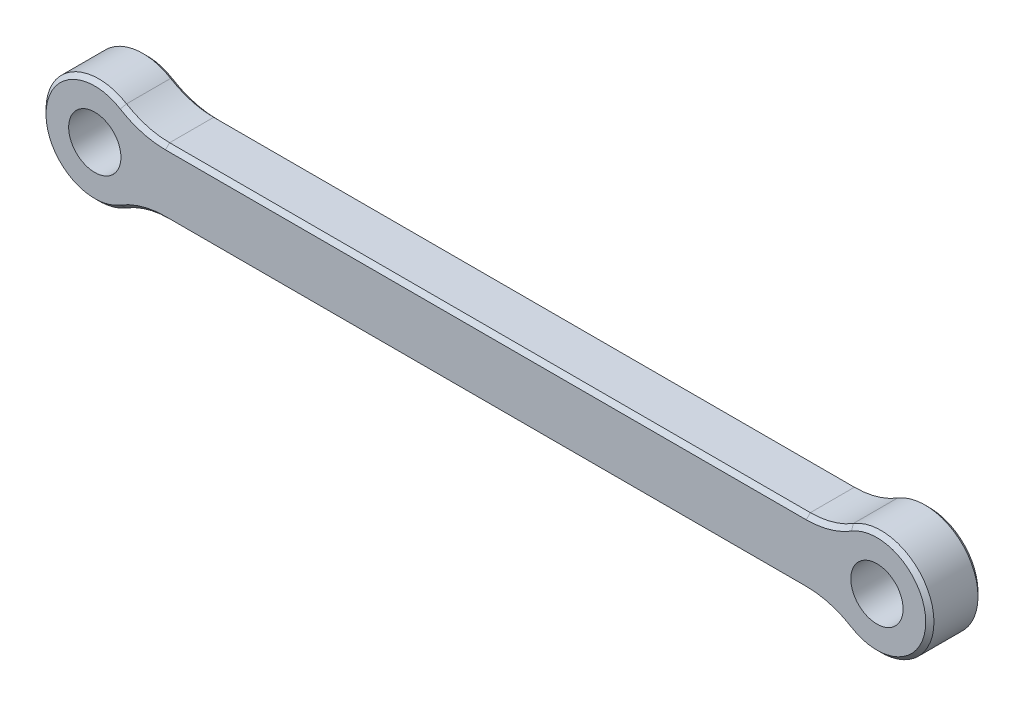
from build123d import *

# Parameters (mm, degrees)
SKETCH2_R           = 3.175
BOSS_EXTRUDE1_DEPTH = 6.35
FILLET1_R           = 10
CHAMFER1_SIZE       = 0.5


with BuildPart() as part:
    # Sketch2 → Boss-Extrude1 (new body)
    with BuildSketch(Plane.XY):
        with BuildLine():
            ThreePointArc((5.027984189, 4), (-6.425, 0), (5.027984189, -4))
            Line((5.027984189, -4), (89.972015811, -4))
            ThreePointArc((89.972015811, -4), (101.425, 0), (89.972015811, 4))
            Line((89.972015811, 4), (5.027984189, 4))
        make_face()
        Circle(SKETCH2_R, mode=Mode.SUBTRACT)
        with Locations((95, 0)):
            Circle(SKETCH2_R, mode=Mode.SUBTRACT)
    extrude(amount=BOSS_EXTRUDE1_DEPTH)

    # Fillet1
    fillet1_edges = [part.edges().sort_by_distance(p)[0] for p in [
        (89.972015811, 4, 3.175),
        (89.972015811, -4, 3.175),
        (5.027984189, -4, 3.175),
        (5.027984189, 4, 3.175),
    ]]
    fillet(fillet1_edges, radius=FILLET1_R)

    # Chamfer1
    chamfer1_edges = [part.edges().sort_by_distance(p)[0] for p in [
        (47.5, -4, 0),
        (47.5, 4, 0),
        (47.5, -4, 6.35),
        (47.5, 4, 6.35),
        (5.872573986, -4.376177452, 0),
        (89.127426014, -4.376177452, 0),
        (-6.425, 0, 0),
        (101.425, 0, 0),
        (5.872573986, 4.376177452, 0),
        (89.127426014, 4.376177452, 0),
        (5.872573986, -4.376177452, 6.35),
        (89.127426014, -4.376177452, 6.35),
        (-6.425, 0, 6.35),
        (101.425, 0, 6.35),
        (5.872573986, 4.376177452, 6.35),
        (89.127426014, 4.376177452, 6.35),
    ]]
    chamfer(chamfer1_edges, length=CHAMFER1_SIZE)


solid = part.part
